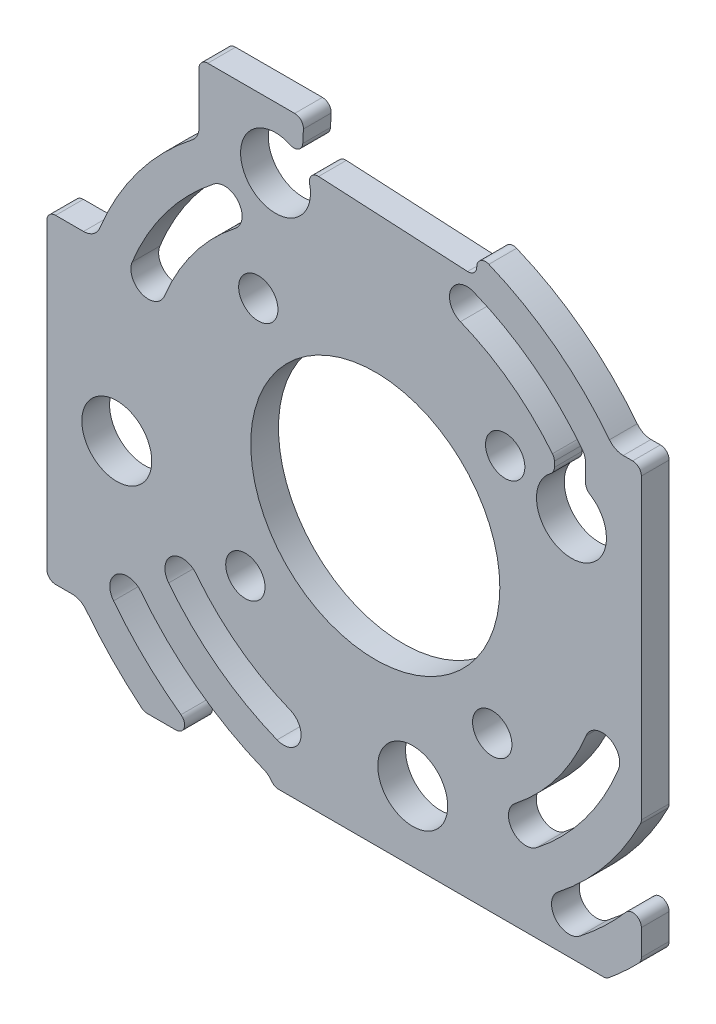
from build123d import *

# Parameters (mm, degrees)
SKETCH1_R               = 14.25
SKETCH1_R_2             = 4
BOSS_EXTRUDE1_DEPTH     = 3.175
M4_CLEARANCE_HOLE1_D    = 4.5
VENTHOLES_DEPTH         = 65.263003169
CIRPATTERN1_COUNT       = 4
CUT_EXTRUDE2_DEPTH      = 65.263003169
CUT_EXTRUDE3_DEPTH      = 65.263003169
CUT_EXTRUDE3_DEPTH_BACK = 65.263003169
SKETCH7_W               = 68.017867909
SKETCH7_H               = 13.211155311
CUT_EXTRUDE4_DEPTH      = 52.625675669
CUT_EXTRUDE4_DEPTH_BACK = 52.625675669
CUT_EXTRUDE5_DEPTH      = 52.625675669
CUT_EXTRUDE5_DEPTH_BACK = 52.625675669
FILLET1_R               = 1


with BuildPart() as part:
    # Sketch1 → Boss-Extrude1 (new body)
    with BuildSketch(Plane.XY):
        Polygon((30.444907858, -32.62998798), (-37.572960051, -32.62998798), (-37.572960051, 52.037732697), (30.444907858, 48.473067289), align=None)
        Circle(SKETCH1_R, mode=Mode.SUBTRACT)
        with Locations((-29.572960051, -7.37834899)):
            Circle(SKETCH1_R_2, mode=Mode.SUBTRACT)
        with Locations((-11.413340062, 28.261911978)):
            Circle(SKETCH1_R_2, mode=Mode.SUBTRACT)
        with Locations((22.444907858, 11.010272988)):
            Circle(SKETCH1_R_2, mode=Mode.SUBTRACT)
        with Locations((4.285287868, -24.62998798)):
            Circle(SKETCH1_R_2, mode=Mode.SUBTRACT)
    extrude(amount=BOSS_EXTRUDE1_DEPTH)

    # M4 Clearance Hole1 (through all)
    with Locations(Plane(origin=(0, 0, 0), x_dir=(-1, 0, 0), z_dir=(0, 0, -1))):
        with Locations((-14.86289651, 13.382612127), (13.382612127, 14.86289651), (14.86289651, -13.382612127), (-13.382612127, -14.86289651)):
            Hole(M4_CLEARANCE_HOLE1_D / 2)

    # Sketch4 → VentHoles (cut, through all)
    with BuildSketch(Plane.XY):
        with BuildLine():
            ThreePointArc((-23.395136062, 29.944408637), (-30.348149382, 22.86897088), (-35.232986474, 14.23505055))
            ThreePointArc((-35.232986474, 14.23505055), (-34.127831951, 11.631469654), (-31.524251055, 12.736624176))
            ThreePointArc((-31.524251055, 12.736624176), (-27.153607342, 20.461710787), (-20.932490161, 26.792365623))
            ThreePointArc((-20.932490161, 26.792365623), (-20.587791605, 29.59971008), (-23.395136062, 29.944408637))
        make_face()
        with BuildLine():
            ThreePointArc((-18.46984426, 23.640322608), (-23.959065301, 18.054450695), (-27.815515637, 11.238197802))
            ThreePointArc((-27.815515637, 11.238197802), (-26.710361115, 8.634616906), (-24.106780219, 9.739771429))
            ThreePointArc((-24.106780219, 9.739771429), (-20.764523261, 15.647190602), (-16.007198358, 20.488279594))
            ThreePointArc((-16.007198358, 20.488279594), (-15.662499802, 23.295624052), (-18.46984426, 23.640322608))
        make_face()
        with BuildLine():
            ThreePointArc((-42.65045731, 17.231903297), (-41.545302788, 14.628322401), (-38.941721892, 15.733476923))
            ThreePointArc((-38.941721892, 15.733476923), (-33.542691422, 25.276230972), (-25.857781964, 33.096451651))
            ThreePointArc((-25.857781964, 33.096451651), (-25.513083407, 35.903796109), (-28.320427865, 36.248494666))
            ThreePointArc((-28.320427865, 36.248494666), (-36.737233462, 27.683491065), (-42.65045731, 17.231903297))
        make_face()
    ventholes = extrude(amount=VENTHOLES_DEPTH, mode=Mode.SUBTRACT)

    # CirPattern1: VentHoles ×4 about axis
    cirpattern1_axis = Axis((0, 0, 3.175), (0, 0, -1))
    for i in range(1, CIRPATTERN1_COUNT):
        add(ventholes.rotate(cirpattern1_axis, i * 360 / CIRPATTERN1_COUNT), mode=Mode.SUBTRACT)

    # Sketch5 → Cut-Extrude2 (cut, through all)
    with BuildSketch(Plane.XY):
        Polygon((12.341413378, 44.414969502), (11.556374035, 29.43552648), (-8.41621666, 30.482245605), (-7.631177317, 45.461688626), align=None)
    extrude(amount=CUT_EXTRUDE2_DEPTH, mode=Mode.SUBTRACT)

    # Sketch7 → Cut-Extrude3 (cut, two sides: drawn at the far end of the back side and taken through both)
    with BuildSketch(Plane.XY.offset(-CUT_EXTRUDE3_DEPTH_BACK)):
        with Locations((-3.564026097, 41.867489633)):
            Rectangle(SKETCH7_W, SKETCH7_H)
    extrude(amount=CUT_EXTRUDE3_DEPTH + CUT_EXTRUDE3_DEPTH_BACK, mode=Mode.SUBTRACT)


with BuildPart() as cut_extrude3_piece_1:
    # of the separate pieces the step leaves, piece 1, a body of its own (cut_extrude3_pieces)
    add(part.part.solids().sort_by_distance((26.443976335, -32.62998798, 0))[0])

    # Sketch9 → Cut-Extrude4 (cut, two sides: drawn at the far end of the back side and taken through both)
    with BuildSketch(Plane.XY.offset(3.175).offset(-CUT_EXTRUDE4_DEPTH_BACK)):
        with BuildLine():
            ThreePointArc((24.064301101, 17.238521309), (22.71543741, 15.347484158), (20.488279594, 16.007198358))
            Line((20.488279594, 16.007198358), (20.488279594, 14.499055847))
            ThreePointArc((20.488279594, 14.499055847), (22.256357537, 15.005826613), (24.064301101, 14.667808432))
            Line((24.064301101, 14.667808432), (24.064301101, 17.238521309))
        make_face()
    extrude(amount=CUT_EXTRUDE4_DEPTH + CUT_EXTRUDE4_DEPTH_BACK, mode=Mode.SUBTRACT)

    # Sketch10 → Cut-Extrude5 (cut, two sides: drawn at the far end of the back side and taken through both)
    with BuildSketch(Plane.XY.offset(3.175).offset(-CUT_EXTRUDE5_DEPTH_BACK)):
        Polygon((-30.450066979, -32.62998798), (-34.672473159, -25.089104914), (-37.572960051, -25.089104914), (-37.572960051, -32.62998798), align=None)
        with BuildLine():
            Line((-37.572960051, 18.768928392), (-37.572960051, 11.485837363))
            Line((-37.572960051, 11.485837363), (-33.378618764, 11.485837363))
            ThreePointArc((-33.378618764, 11.485837363), (-35.03669391, 12.367451556), (-35.232986474, 14.23505055))
            ThreePointArc((-35.232986474, 14.23505055), (-30.348149382, 22.86897088), (-23.395136062, 29.944408637))
            ThreePointArc((-23.395136062, 29.944408637), (-21.287070818, 30.165975222), (-20.163813112, 28.36838713))
            Line((-20.163813112, 28.36838713), (-20.163813112, 35.261911978))
            Line((-20.163813112, 35.261911978), (-25.17793724, 35.261911978))
            ThreePointArc((-25.17793724, 35.261911978), (-25.180933948, 34.073404246), (-25.857781964, 33.096451651))
            ThreePointArc((-25.857781964, 33.096451651), (-32.514369728, 26.586006868), (-37.572960051, 18.768928392))
        make_face()
        Polygon((11.775698683, 36.985955285), (28.36838713, 20.163813112), (30.444907858, 20.163813112), (30.444907858, 36.985955285), align=None)
    extrude(amount=CUT_EXTRUDE5_DEPTH + CUT_EXTRUDE5_DEPTH_BACK, mode=Mode.SUBTRACT)

    # Fillet1
    fillet1_edges = [cut_extrude3_piece_1.edges().sort_by_distance(p)[0] for p in [
        (30.444907858, -28.932811573, 1.5875),
        (26.443976335, -32.62998798, 1.5875),
        (-11.631234454, -32.62998798, 1.5875),
        (-19.475212051, -32.62998798, 1.5875),
        (11.714368197, 32.450234687, 1.5875),
        (-8.16572496, 35.261911978, 1.5875),
        (-26.443976335, -32.62998798, 1.5875),
        (11.556374035, 29.43552648, 1.5875),
        (-8.395017915, 30.886741766, 1.5875),
        (-8.07427182, 30.464325035, 1.5875),
        (20.488279594, 16.007198358, 1.5875),
        (20.488279594, 14.499055847, 1.5875),
        (24.064301101, 14.667808432, 1.5875),
        (30.444907858, -22.739999682, 1.5875),
        (-37.572960051, -25.089104914, 1.5875),
        (30.444907858, -15.136300259, 1.5875),
        (30.444907858, 20.163813112, 1.5875),
        (-20.163813112, 35.261911978, 1.5875),
        (-37.572960051, 11.485837363, 1.5875),
    ]]
    fillet(fillet1_edges, radius=FILLET1_R)


with BuildPart() as cut_extrude3_piece_2:
    # of the separate pieces the step leaves, piece 2, a body of its own (cut_extrude3_pieces)
    add(part.part.solids().sort_by_distance((30.444907858, 48.473067289, 0))[0])


with BuildPart() as cut_extrude3_piece_3:
    # of the separate pieces the step leaves, piece 3, a body of its own (cut_extrude3_pieces)
    add(part.part.solids().sort_by_distance((-37.572960051, 35.261911978, 0))[0])


with BuildPart() as cut_extrude3_piece_4:
    # of the separate pieces the step leaves, piece 4, a body of its own (cut_extrude3_pieces)
    add(part.part.solids().sort_by_distance((29.539762417, 35.261911978, 0))[0])


with BuildPart() as cut_extrude3_piece_5:
    # of the separate pieces the step leaves, piece 5, a body of its own (cut_extrude3_pieces)
    add(part.part.solids().sort_by_distance((11.86172196, 35.261911978, 0))[0])


solid = cut_extrude3_piece_1.part
